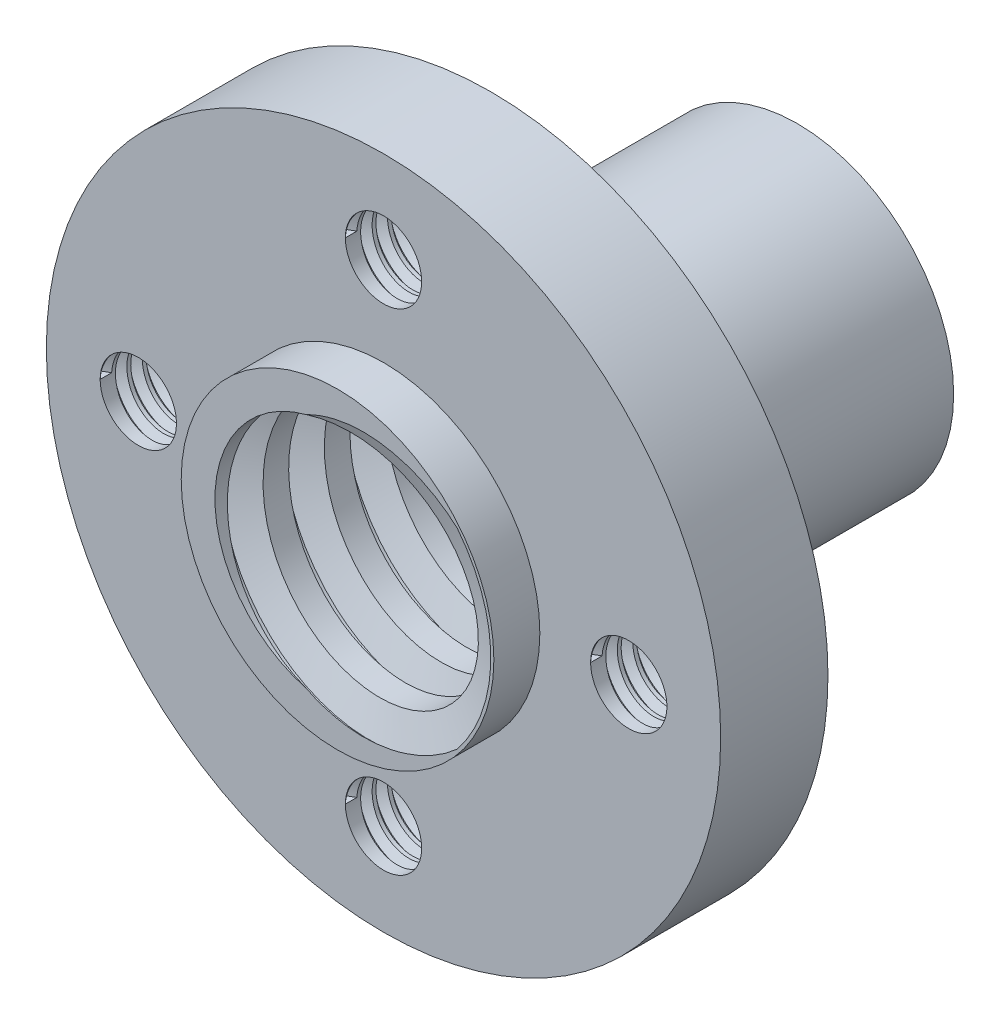
from build123d import *
from build123d.topology import SkipClean

# Parameters (mm, degrees)
SKETCH1_R                = 11
SKETCH1_R_2              = 5.1
SKETCH1_R_3              = 1.2446
BOSS_EXTRUDE1_DEPTH      = 3.5
BOSS_EXTRUDE2_DEPTH      = 1.5
BOSS_EXTRUDE2_DEPTH_BACK = 13.5
SKETCH2_R                = 5.1
SKETCH2_R_2              = 4
CUT_SWEEP1_PITCH         = 2
THREAD1_PITCH            = 0.5
THREAD2_PITCH            = 0.5
THREAD3_PITCH            = 0.5
THREAD4_PITCH            = 0.5


with BuildPart() as part:
    # Sketch1 → Boss-Extrude1 (new body)
    with BuildSketch(Plane.XY):
        Circle(SKETCH1_R)
        Circle(SKETCH1_R_2, mode=Mode.SUBTRACT)
        with Locations((0, 8)):
            Circle(SKETCH1_R_3, mode=Mode.SUBTRACT)
        with Locations((8, 0)):
            Circle(SKETCH1_R_3, mode=Mode.SUBTRACT)
        with Locations((0, -8)):
            Circle(SKETCH1_R_3, mode=Mode.SUBTRACT)
        with Locations((-8, 0)):
            Circle(SKETCH1_R_3, mode=Mode.SUBTRACT)
    extrude(amount=-BOSS_EXTRUDE1_DEPTH)

    # Sketch2 → Boss-Extrude2 (add, two sides: drawn at the far end of the back side and taken through both)
    with BuildSketch(Plane.XY.offset(-BOSS_EXTRUDE2_DEPTH_BACK)):
        Circle(SKETCH2_R)
        Circle(SKETCH2_R_2, mode=Mode.SUBTRACT)
    extrude(amount=BOSS_EXTRUDE2_DEPTH + BOSS_EXTRUDE2_DEPTH_BACK)

    # Cut-Sweep1: arcs per turn and ends read off the stored shape
    # Cut-Sweep1: the profile of Sketch4 screwed along a right-hand helix through 9 turns, 10 arcs to a turn; built about Z, then put on its axis
    cut_sweep1_z = Axis((0, 0, 0), (0, 0, 1))
    cut_sweep1_corners = [(3, 0, -1.05), (3, 0, -2.95), (5, 0, -2.214588815), (5, 0, -1.785411185)]
    with BuildLine(mode=Mode.PRIVATE) as cut_sweep1_profile:
        Line(cut_sweep1_corners[0], cut_sweep1_corners[1])
        Line(cut_sweep1_corners[1], cut_sweep1_corners[2])
        Line(cut_sweep1_corners[2], cut_sweep1_corners[3])
        Line(cut_sweep1_corners[3], cut_sweep1_corners[0])
    cut_sweep1_cap = Face(cut_sweep1_profile.wire())
    cut_sweep1_turn_angles = [0, 18, 36, 54, 72, 90, 108, 126, 144, 162, 180, 198, 216, 234, 252, 270, 288, 306, 324, 342, 360]
    cut_sweep1_turn_weights = [1, 0.9510565162951535, 1, 0.9510565162951535, 1, 0.9510565162951535, 1, 0.9510565162951535, 1, 0.9510565162951535, 1, 0.9510565162951535, 1, 0.9510565162951535, 1, 0.9510565162951535, 1, 0.9510565162951535, 1, 0.9510565162951535, 1]
    cut_sweep1_turn_rails = [Edge.make_bspline([Vector(p[0], p[1], 0).rotate(cut_sweep1_z, cut_sweep1_turn_angles[k]) / cut_sweep1_turn_weights[k] + Vector(0, 0, p[2] + CUT_SWEEP1_PITCH * cut_sweep1_turn_angles[k] / 360) for k in range(21)], [0, 0, 0, 1, 1, 2, 2, 3, 3, 4, 4, 5, 5, 6, 6, 7, 7, 8, 8, 9, 9, 10, 10, 10], 2, cut_sweep1_turn_weights) for p in cut_sweep1_corners]
    cut_sweep1_turn_sides = [Face.make_surface_from_curves(cut_sweep1_turn_rails[p[0]], cut_sweep1_turn_rails[p[1]]) for p in [(0, 1), (1, 2), (2, 3), (3, 0)]]
    cut_sweep1 = Plane(origin=(0, 0, 1.5), x_dir=(1, 0, 0), z_dir=(0, 0, -1)) * Solid(Shell([*[p.moved(Location((0, 0, CUT_SWEEP1_PITCH * i))) for i in range(9) for p in cut_sweep1_turn_sides], cut_sweep1_cap, cut_sweep1_cap.rotate(cut_sweep1_z, 3240).moved(Location((0, 0, CUT_SWEEP1_PITCH * 3240 / 360)))]))
    add(cut_sweep1, mode=Mode.SUBTRACT)

    # Thread1: arcs per turn and ends read off the stored shape
    # Thread1: the profile of Thread Profile1 profile screwed along a right-hand helix through 7 turns, 6 arcs to a turn; built about Z, then put on its axis
    with SkipClean():  # the faces are left unmerged after this step: merging them gives an invalid solid
        thread1_z = Axis((0, 0, 0), (0, 0, 1))
        thread1_corners = [(1.2443, 0, -0.000173205), (1.515232937, 0, 0.156249999), (1.515232937, 0, 0.218749999), (1.2443, 0, 0.375173204)]
        with BuildLine(mode=Mode.PRIVATE) as thread1_profile:
            Line(thread1_corners[0], thread1_corners[1])
            Line(thread1_corners[1], thread1_corners[2])
            Line(thread1_corners[2], thread1_corners[3])
            Line(thread1_corners[3], thread1_corners[0])
        thread1_cap = Face(thread1_profile.wire())
        thread1_turn_angles = [0, 30, 60, 90, 120, 150, 180, 210, 240, 270, 300, 330, 360]
        thread1_turn_weights = [1, 0.8660254037844387, 1, 0.8660254037844387, 1, 0.8660254037844387, 1, 0.8660254037844387, 1, 0.8660254037844387, 1, 0.8660254037844387, 1]
        thread1_turn_rails = [Edge.make_bspline([Vector(p[0], p[1], 0).rotate(thread1_z, thread1_turn_angles[k]) / thread1_turn_weights[k] + Vector(0, 0, p[2] + THREAD1_PITCH * thread1_turn_angles[k] / 360) for k in range(13)], [0, 0, 0, 1, 1, 2, 2, 3, 3, 4, 4, 5, 5, 6, 6, 6], 2, thread1_turn_weights) for p in thread1_corners]
        thread1_turn_sides = [Face.make_surface_from_curves(thread1_turn_rails[p[0]], thread1_turn_rails[p[1]]) for p in [(0, 1), (1, 2), (2, 3), (3, 0)]]
        thread1 = Plane(origin=(8, 0, 0), x_dir=(-1, 0, 0), z_dir=(0, 0, -1)) * Solid(Shell([*[p.moved(Location((0, 0, THREAD1_PITCH * i))) for i in range(7) for p in thread1_turn_sides], thread1_cap, thread1_cap.rotate(thread1_z, 2520).moved(Location((0, 0, THREAD1_PITCH * 2520 / 360)))]))
        add(thread1, mode=Mode.SUBTRACT)

    # Thread2: arcs per turn and ends read off the stored shape
    # Thread2: the profile of Thread Profile2 profile screwed along a right-hand helix through 7 turns, 6 arcs to a turn; built about Z, then put on its axis
    with SkipClean():  # the faces are left unmerged after this step: merging them gives an invalid solid
        thread2_z = Axis((0, 0, 0), (0, 0, 1))
        thread2_corners = [(1.2443, 0, -0.000173205), (1.515232937, 0, 0.156249999), (1.515232937, 0, 0.218749999), (1.2443, 0, 0.375173204)]
        with BuildLine(mode=Mode.PRIVATE) as thread2_profile:
            Line(thread2_corners[0], thread2_corners[1])
            Line(thread2_corners[1], thread2_corners[2])
            Line(thread2_corners[2], thread2_corners[3])
            Line(thread2_corners[3], thread2_corners[0])
        thread2_cap = Face(thread2_profile.wire())
        thread2_turn_angles = [0, 30, 60, 90, 120, 150, 180, 210, 240, 270, 300, 330, 360]
        thread2_turn_weights = [1, 0.8660254037844387, 1, 0.8660254037844387, 1, 0.8660254037844387, 1, 0.8660254037844387, 1, 0.8660254037844387, 1, 0.8660254037844387, 1]
        thread2_turn_rails = [Edge.make_bspline([Vector(p[0], p[1], 0).rotate(thread2_z, thread2_turn_angles[k]) / thread2_turn_weights[k] + Vector(0, 0, p[2] + THREAD2_PITCH * thread2_turn_angles[k] / 360) for k in range(13)], [0, 0, 0, 1, 1, 2, 2, 3, 3, 4, 4, 5, 5, 6, 6, 6], 2, thread2_turn_weights) for p in thread2_corners]
        thread2_turn_sides = [Face.make_surface_from_curves(thread2_turn_rails[p[0]], thread2_turn_rails[p[1]]) for p in [(0, 1), (1, 2), (2, 3), (3, 0)]]
        thread2 = Plane(origin=(0, 8, 0), x_dir=(-1, 0, 0), z_dir=(0, 0, -1)) * Solid(Shell([*[p.moved(Location((0, 0, THREAD2_PITCH * i))) for i in range(7) for p in thread2_turn_sides], thread2_cap, thread2_cap.rotate(thread2_z, 2520).moved(Location((0, 0, THREAD2_PITCH * 2520 / 360)))]))
        add(thread2, mode=Mode.SUBTRACT)

    # Thread3: arcs per turn and ends read off the stored shape
    # Thread3: the profile of Thread Profile3 profile screwed along a right-hand helix through 7 turns, 6 arcs to a turn; built about Z, then put on its axis
    with SkipClean():  # the faces are left unmerged after this step: merging them gives an invalid solid
        thread3_z = Axis((0, 0, 0), (0, 0, 1))
        thread3_corners = [(1.2443, 0, -0.000173205), (1.515232937, 0, 0.156249999), (1.515232937, 0, 0.218749999), (1.2443, 0, 0.375173204)]
        with BuildLine(mode=Mode.PRIVATE) as thread3_profile:
            Line(thread3_corners[0], thread3_corners[1])
            Line(thread3_corners[1], thread3_corners[2])
            Line(thread3_corners[2], thread3_corners[3])
            Line(thread3_corners[3], thread3_corners[0])
        thread3_cap = Face(thread3_profile.wire())
        thread3_turn_angles = [0, 30, 60, 90, 120, 150, 180, 210, 240, 270, 300, 330, 360]
        thread3_turn_weights = [1, 0.8660254037844387, 1, 0.8660254037844387, 1, 0.8660254037844387, 1, 0.8660254037844387, 1, 0.8660254037844387, 1, 0.8660254037844387, 1]
        thread3_turn_rails = [Edge.make_bspline([Vector(p[0], p[1], 0).rotate(thread3_z, thread3_turn_angles[k]) / thread3_turn_weights[k] + Vector(0, 0, p[2] + THREAD3_PITCH * thread3_turn_angles[k] / 360) for k in range(13)], [0, 0, 0, 1, 1, 2, 2, 3, 3, 4, 4, 5, 5, 6, 6, 6], 2, thread3_turn_weights) for p in thread3_corners]
        thread3_turn_sides = [Face.make_surface_from_curves(thread3_turn_rails[p[0]], thread3_turn_rails[p[1]]) for p in [(0, 1), (1, 2), (2, 3), (3, 0)]]
        thread3 = Plane(origin=(-8, 0, 0), x_dir=(-1, 0, 0), z_dir=(0, 0, -1)) * Solid(Shell([*[p.moved(Location((0, 0, THREAD3_PITCH * i))) for i in range(7) for p in thread3_turn_sides], thread3_cap, thread3_cap.rotate(thread3_z, 2520).moved(Location((0, 0, THREAD3_PITCH * 2520 / 360)))]))
        add(thread3, mode=Mode.SUBTRACT)

    # Thread4: arcs per turn and ends read off the stored shape
    # Thread4: the profile of Thread Profile4 profile screwed along a right-hand helix through 7 turns, 6 arcs to a turn; built about Z, then put on its axis
    with SkipClean():  # the faces are left unmerged after this step: merging them gives an invalid solid
        thread4_z = Axis((0, 0, 0), (0, 0, 1))
        thread4_corners = [(1.2443, 0, -0.000173205), (1.515232937, 0, 0.156249999), (1.515232937, 0, 0.218749999), (1.2443, 0, 0.375173204)]
        with BuildLine(mode=Mode.PRIVATE) as thread4_profile:
            Line(thread4_corners[0], thread4_corners[1])
            Line(thread4_corners[1], thread4_corners[2])
            Line(thread4_corners[2], thread4_corners[3])
            Line(thread4_corners[3], thread4_corners[0])
        thread4_cap = Face(thread4_profile.wire())
        thread4_turn_angles = [0, 30, 60, 90, 120, 150, 180, 210, 240, 270, 300, 330, 360]
        thread4_turn_weights = [1, 0.8660254037844387, 1, 0.8660254037844387, 1, 0.8660254037844387, 1, 0.8660254037844387, 1, 0.8660254037844387, 1, 0.8660254037844387, 1]
        thread4_turn_rails = [Edge.make_bspline([Vector(p[0], p[1], 0).rotate(thread4_z, thread4_turn_angles[k]) / thread4_turn_weights[k] + Vector(0, 0, p[2] + THREAD4_PITCH * thread4_turn_angles[k] / 360) for k in range(13)], [0, 0, 0, 1, 1, 2, 2, 3, 3, 4, 4, 5, 5, 6, 6, 6], 2, thread4_turn_weights) for p in thread4_corners]
        thread4_turn_sides = [Face.make_surface_from_curves(thread4_turn_rails[p[0]], thread4_turn_rails[p[1]]) for p in [(0, 1), (1, 2), (2, 3), (3, 0)]]
        thread4 = Plane(origin=(0, -8, 0), x_dir=(-1, 0, 0), z_dir=(0, 0, -1)) * Solid(Shell([*[p.moved(Location((0, 0, THREAD4_PITCH * i))) for i in range(7) for p in thread4_turn_sides], thread4_cap, thread4_cap.rotate(thread4_z, 2520).moved(Location((0, 0, THREAD4_PITCH * 2520 / 360)))]))
        add(thread4, mode=Mode.SUBTRACT)


solid = part.part
